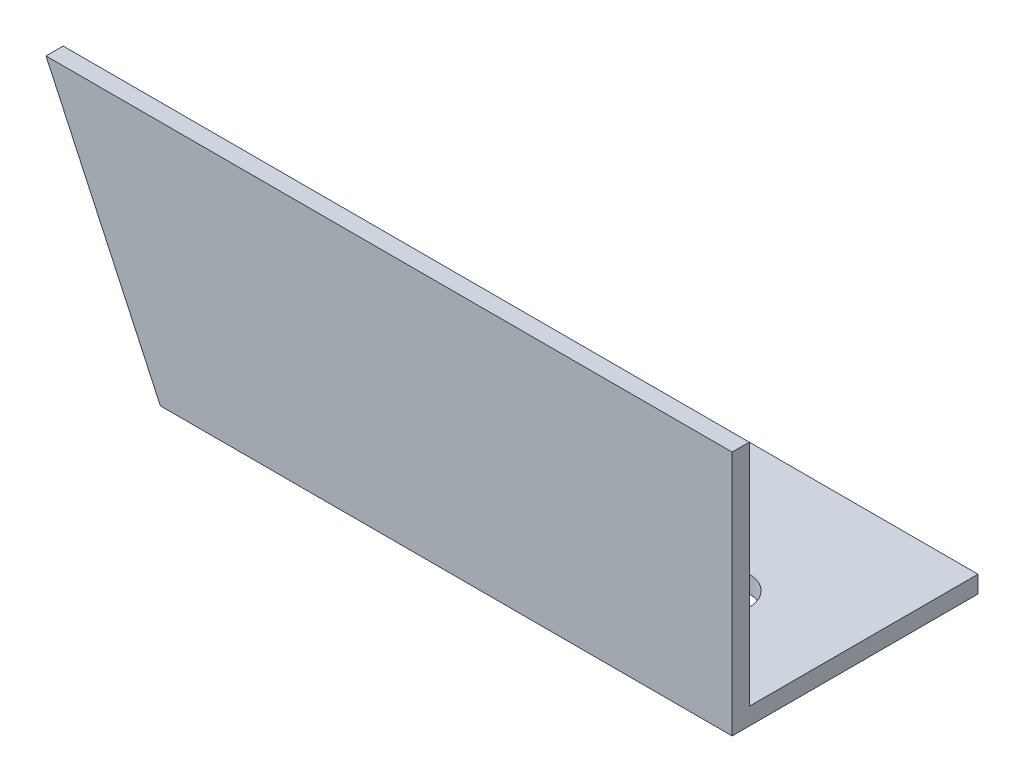
from build123d import *

# Parameters (mm, degrees)
EXTRUDE_1_DEPTH     = 120
CUT_EXTRUDE_1_DEPTH = 50
SKETCH_3_R          = 5
CUT_EXTRUDE_2_DEPTH = 10


with BuildPart() as part:
    # Эскиз1 → Вытянуть-Тонкостенный1 (new body)
    with BuildSketch(Plane(origin=(0, 0, 0), x_dir=(0, 0, -1), z_dir=(1, 0, 0))):
        Polygon((0, 40), (0, 0), (40, 0), (40, -3), (-3, -3), (-3, 40), align=None)
    extrude(amount=EXTRUDE_1_DEPTH)

    # Эскиз2 → Вырез-Вытянуть1 (cut)
    with BuildSketch(Plane.XY.offset(3)):
        Polygon((0, 40), (20, -3), (0, -3), align=None)
    extrude(amount=-CUT_EXTRUDE_1_DEPTH, mode=Mode.SUBTRACT)

    # Эскиз3 → Вырез-Вытянуть2 (cut)
    with BuildSketch(Plane.XZ.offset(3)):
        with Locations((100, -15)):
            Circle(SKETCH_3_R)
    extrude(amount=-CUT_EXTRUDE_2_DEPTH, mode=Mode.SUBTRACT)


solid = part.part
